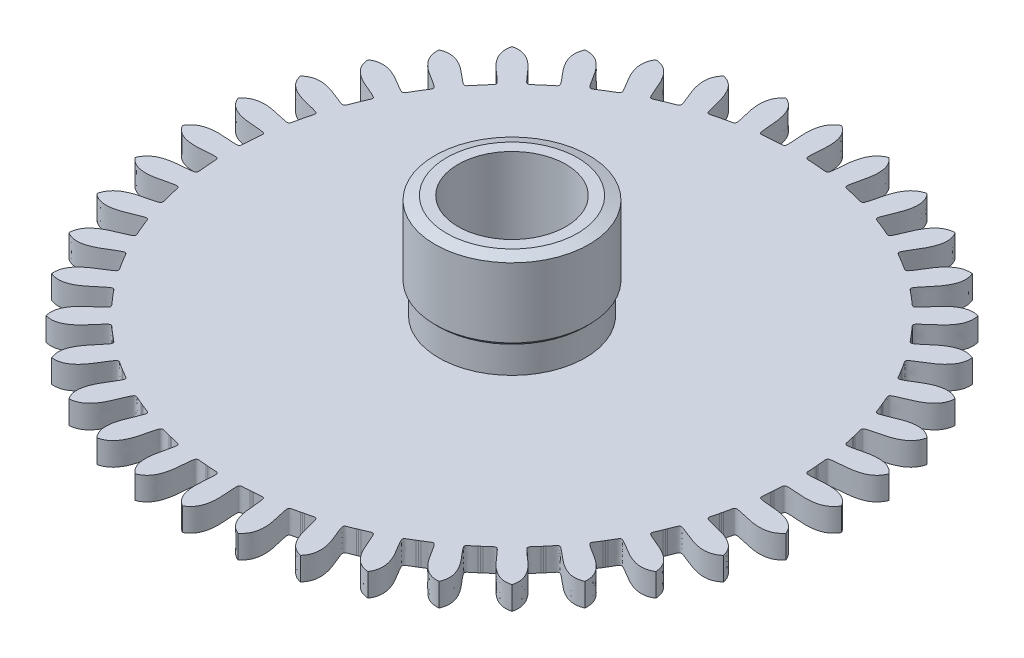
from build123d import *

# Parameters (mm, degrees)
BOSS_EXTRUDE1_40_TEETH_DEPTH = 0.3
SKETCH2_R                    = 0.95
BOSS_EXTRUDE2_DEPTH          = 0.35
SKETCH3_R                    = 1
BOSS_EXTRUDE3_DEPTH          = 1
CHAMFER1_SIZE                = 0.05
CHAMFER2_SIZE                = 0.05
CHAMFER2_SIZE2               = 0.15
CUT_EXTRUDE1_REACH           = 8.267
SKETCH4_R                    = 0.7


with BuildPart() as part:
    # Sketch1 → Boss-Extrude1 (40 teeth) (new body)
    with BuildSketch(Plane(origin=(0, 0, 0), x_dir=(1, 0, 0), z_dir=(0, 1, 0))):
        with BuildLine():
            Line((0.266399927, 3.665331646), (0.288337177, 3.663671201))
            Line((0.288337177, 3.663671201), (0.310264093, 3.661879462))
            add(Edge.make_bspline(
                [(0.668757338, 4.222367656), (0.581360588, 4.18682388), (0.475637691, 4.103302571), (0.459945668, 3.779977251), (0.454094522, 3.734621658), (0.440823774, 3.627045038), (0.415580001, 3.65779408), (0.310264093, 3.661879462)],
                knots=[0, 0, 0, 0, 0.596043429, 0.670236356, 0.733963386, 0.767736338, 1, 1, 1, 1], degree=3))
            add(Edge.make_bspline(
                [(0.668757338, 4.222367656), (0.740892956, 4.161556435), (0.815631902, 4.049452778), (0.730642884, 3.737103023), (0.722192005, 3.692159188), (0.701570233, 3.585746856), (0.735080464, 3.607190178), (0.836504297, 3.578531202)],
                knots=[0, 0, 0, 0, 0.596043429, 0.670236356, 0.733963386, 0.767736338, 1, 1, 1, 1], degree=3))
            Line((0.836504297, 3.578531202), (0.857911712, 3.573459457))
            Line((0.857911712, 3.573459457), (0.879288382, 3.568259652))
            add(Edge.make_bspline(
                [(1.321047651, 4.065766607), (1.229166628, 4.044332298), (1.111679745, 3.978377979), (1.045601692, 3.661488104), (1.032727406, 3.617606234), (1.002791352, 3.513430064), (0.982668582, 3.54774953), (0.879288382, 3.568259652)],
                knots=[0, 0, 0, 0, 0.596043429, 0.670236356, 0.733963386, 0.767736338, 1, 1, 1, 1], degree=3))
            add(Edge.make_bspline(
                [(1.321047651, 4.065766607), (1.382782189, 3.994419576), (1.439064099, 3.872004355), (1.30625917, 3.576795355), (1.290881571, 3.533726862), (1.253867131, 3.431850598), (1.29031927, 3.447787762), (1.386011155, 3.403615442)],
                knots=[0, 0, 0, 0, 0.596043429, 0.670236356, 0.733963386, 0.767736338, 1, 1, 1, 1], degree=3))
            Line((1.386011155, 3.403615442), (1.406361614, 3.395257282))
            Line((1.406361614, 3.395257282), (1.426661673, 3.386777446))
            add(Edge.make_bspline(
                [(1.940809386, 3.809052891), (1.846706507, 3.802255832), (1.720348553, 3.755492519), (1.605511533, 3.452840968), (1.585931114, 3.411513339), (1.540066879, 3.313302781), (1.525560601, 3.350347612), (1.426661673, 3.386777446)],
                knots=[0, 0, 0, 0, 0.596043429, 0.670236356, 0.733963386, 0.767736338, 1, 1, 1, 1], degree=3))
            add(Edge.make_bspline(
                [(1.940809386, 3.809052891), (1.990622735, 3.728926851), (2.027061761, 3.599214333), (1.84971102, 3.328415114), (1.827785348, 3.288282452), (1.775289658, 3.193450789), (1.813786132, 3.203489368), (1.901389819, 3.144891374)],
                knots=[0, 0, 0, 0, 0.596043429, 0.670236356, 0.733963386, 0.767736338, 1, 1, 1, 1], degree=3))
            Line((1.901389819, 3.144891374), (1.920182225, 3.133452604))
            Line((1.920182225, 3.133452604), (1.938905818, 3.12190154))
            add(Edge.make_bspline(
                [(2.512781954, 3.458547651), (2.418774342, 3.466555209), (2.286656671, 3.440134368), (2.125888352, 3.159173428), (2.100083935, 3.121417663), (2.039420848, 3.031590987), (2.030888255, 3.070449017), (1.938905818, 3.12190154)],
                knots=[0, 0, 0, 0, 0.596043429, 0.670236356, 0.733963386, 0.767736338, 1, 1, 1, 1], degree=3))
            add(Edge.make_bspline(
                [(2.512781954, 3.458547651), (2.549447543, 3.371615571), (2.565146436, 3.23779971), (2.347616846, 2.998078247), (2.319682983, 2.961869615), (2.252998662, 2.876417622), (2.292591561, 2.880310435), (2.369949955, 2.808729644)],
                knots=[0, 0, 0, 0, 0.596043429, 0.670236356, 0.733963386, 0.767736338, 1, 1, 1, 1], degree=3))
            Line((2.369949955, 2.808729644), (2.386721578, 2.794491924))
            Line((2.386721578, 2.794491924), (2.403407668, 2.780154058))
            add(Edge.make_bspline(
                [(3.02288149, 3.02288149), (2.931283926, 3.045496492), (2.796659712, 3.040068692), (2.593918744, 2.787716554), (2.562525719, 2.754462325), (2.488557508, 2.675231362), (2.4862087, 2.714945777), (2.403407668, 2.780154058)],
                knots=[0, 0, 0, 0, 0.596043429, 0.670236356, 0.733963386, 0.767736338, 1, 1, 1, 1], degree=3))
            add(Edge.make_bspline(
                [(3.02288149, 3.02288149), (3.045496492, 2.931283926), (3.040068692, 2.796659712), (2.787716554, 2.593918743), (2.754462325, 2.562525719), (2.675231362, 2.488557508), (2.714945777, 2.4862087), (2.780154058, 2.403407668)],
                knots=[0, 0, 0, 0, 0.596043429, 0.670236356, 0.733963386, 0.767736338, 1, 1, 1, 1], degree=3))
            Line((2.780154058, 2.403407668), (2.794491924, 2.386721578))
            Line((2.794491924, 2.386721578), (2.808729644, 2.369949955))
            add(Edge.make_bspline(
                [(3.458547651, 2.512781954), (3.371615571, 2.549447543), (3.23779971, 2.565146436), (2.998078247, 2.347616846), (2.961869615, 2.319682983), (2.876417622, 2.252998662), (2.880310435, 2.292591561), (2.808729644, 2.369949955)],
                knots=[0, 0, 0, 0, 0.596043429, 0.670236356, 0.733963386, 0.767736338, 1, 1, 1, 1], degree=3))
            add(Edge.make_bspline(
                [(3.458547651, 2.512781954), (3.466555209, 2.418774342), (3.440134368, 2.286656671), (3.159173428, 2.125888352), (3.121417663, 2.100083935), (3.031590987, 2.039420848), (3.070449017, 2.030888255), (3.12190154, 1.938905818)],
                knots=[0, 0, 0, 0, 0.596043429, 0.670236356, 0.733963386, 0.767736338, 1, 1, 1, 1], degree=3))
            Line((3.12190154, 1.938905818), (3.133452604, 1.920182225))
            Line((3.133452604, 1.920182225), (3.144891374, 1.901389819))
            add(Edge.make_bspline(
                [(3.809052891, 1.940809386), (3.728926851, 1.990622735), (3.599214333, 2.027061761), (3.328415114, 1.84971102), (3.288282452, 1.827785348), (3.193450789, 1.775289658), (3.203489368, 1.813786132), (3.144891374, 1.901389819)],
                knots=[0, 0, 0, 0, 0.596043429, 0.670236356, 0.733963386, 0.767736338, 1, 1, 1, 1], degree=3))
            add(Edge.make_bspline(
                [(3.809052891, 1.940809386), (3.802255832, 1.846706507), (3.755492519, 1.720348553), (3.452840968, 1.605511533), (3.411513339, 1.585931114), (3.313302781, 1.540066879), (3.350347612, 1.525560601), (3.386777446, 1.426661673)],
                knots=[0, 0, 0, 0, 0.596043429, 0.670236356, 0.733963386, 0.767736338, 1, 1, 1, 1], degree=3))
            Line((3.386777446, 1.426661673), (3.395257282, 1.406361614))
            Line((3.395257282, 1.406361614), (3.403615442, 1.386011155))
            add(Edge.make_bspline(
                [(4.065766607, 1.321047651), (3.994419576, 1.382782189), (3.872004355, 1.439064099), (3.576795355, 1.30625917), (3.533726862, 1.290881571), (3.431850598, 1.253867131), (3.447787762, 1.29031927), (3.403615442, 1.386011155)],
                knots=[0, 0, 0, 0, 0.596043429, 0.670236356, 0.733963386, 0.767736338, 1, 1, 1, 1], degree=3))
            add(Edge.make_bspline(
                [(4.065766607, 1.321047651), (4.044332298, 1.229166628), (3.978377979, 1.111679745), (3.661488104, 1.045601692), (3.617606234, 1.032727406), (3.513430064, 1.002791352), (3.54774953, 0.982668582), (3.568259652, 0.879288382)],
                knots=[0, 0, 0, 0, 0.596043429, 0.670236356, 0.733963386, 0.767736338, 1, 1, 1, 1], degree=3))
            Line((3.568259652, 0.879288382), (3.573459457, 0.857911712))
            Line((3.573459457, 0.857911712), (3.578531202, 0.836504297))
            add(Edge.make_bspline(
                [(4.222367656, 0.668757338), (4.161556435, 0.740892956), (4.049452778, 0.815631902), (3.737103023, 0.730642884), (3.692159188, 0.722192005), (3.585746856, 0.701570233), (3.607190178, 0.735080464), (3.578531202, 0.836504297)],
                knots=[0, 0, 0, 0, 0.596043429, 0.670236356, 0.733963386, 0.767736338, 1, 1, 1, 1], degree=3))
            add(Edge.make_bspline(
                [(4.222367656, 0.668757338), (4.18682388, 0.581360588), (4.103302571, 0.475637691), (3.779977251, 0.459945668), (3.734621658, 0.454094522), (3.627045038, 0.440823774), (3.65779408, 0.415580001), (3.661879462, 0.310264093)],
                knots=[0, 0, 0, 0, 0.596043429, 0.670236356, 0.733963386, 0.767736338, 1, 1, 1, 1], degree=3))
            Line((3.661879462, 0.310264093), (3.663671201, 0.288337177))
            Line((3.663671201, 0.288337177), (3.665331646, 0.266399927))
            add(Edge.make_bspline(
                [(4.275, 0), (4.226221963, 0.08076048), (4.127190235, 0.17211614), (3.805390813, 0.137035746), (3.759678302, 0.135719676), (3.651350126, 0.131998348), (3.6777716, 0.161741538), (3.665331646, 0.266399927)],
                knots=[0, 0, 0, 0, 0.596043429, 0.670236356, 0.733963386, 0.767736338, 1, 1, 1, 1], degree=3))
            add(Edge.make_bspline(
                [(4.275, 0), (4.226221963, -0.08076048), (4.127190235, -0.17211614), (3.805390813, -0.137035746), (3.759678302, -0.135719676), (3.651350126, -0.131998348), (3.6777716, -0.161741538), (3.665331646, -0.266399927)],
                knots=[0, 0, 0, 0, 0.596043429, 0.670236356, 0.733963386, 0.767736338, 1, 1, 1, 1], degree=3))
            Line((3.665331646, -0.266399927), (3.663671201, -0.288337177))
            Line((3.663671201, -0.288337177), (3.661879462, -0.310264093))
            add(Edge.make_bspline(
                [(4.222367656, -0.668757338), (4.18682388, -0.581360588), (4.103302571, -0.475637691), (3.779977251, -0.459945668), (3.734621658, -0.454094522), (3.627045038, -0.440823774), (3.65779408, -0.415580001), (3.661879462, -0.310264093)],
                knots=[0, 0, 0, 0, 0.596043429, 0.670236356, 0.733963386, 0.767736338, 1, 1, 1, 1], degree=3))
            add(Edge.make_bspline(
                [(4.222367656, -0.668757338), (4.161556435, -0.740892956), (4.049452778, -0.815631902), (3.737103023, -0.730642884), (3.692159188, -0.722192005), (3.585746856, -0.701570233), (3.607190178, -0.735080464), (3.578531202, -0.836504297)],
                knots=[0, 0, 0, 0, 0.596043429, 0.670236356, 0.733963386, 0.767736338, 1, 1, 1, 1], degree=3))
            Line((3.578531202, -0.836504297), (3.573459457, -0.857911712))
            Line((3.573459457, -0.857911712), (3.568259652, -0.879288382))
            add(Edge.make_bspline(
                [(4.065766607, -1.321047651), (4.044332298, -1.229166628), (3.978377979, -1.111679745), (3.661488104, -1.045601692), (3.617606234, -1.032727406), (3.513430064, -1.002791352), (3.54774953, -0.982668582), (3.568259652, -0.879288382)],
                knots=[0, 0, 0, 0, 0.596043429, 0.670236356, 0.733963386, 0.767736338, 1, 1, 1, 1], degree=3))
            add(Edge.make_bspline(
                [(4.065766607, -1.321047651), (3.994419576, -1.382782189), (3.872004355, -1.439064099), (3.576795355, -1.30625917), (3.533726862, -1.290881571), (3.431850598, -1.253867131), (3.447787762, -1.29031927), (3.403615442, -1.386011155)],
                knots=[0, 0, 0, 0, 0.596043429, 0.670236356, 0.733963386, 0.767736338, 1, 1, 1, 1], degree=3))
            Line((3.403615442, -1.386011155), (3.395257282, -1.406361614))
            Line((3.395257282, -1.406361614), (3.386777446, -1.426661673))
            add(Edge.make_bspline(
                [(3.809052891, -1.940809386), (3.802255832, -1.846706507), (3.755492519, -1.720348553), (3.452840968, -1.605511533), (3.411513339, -1.585931114), (3.313302781, -1.540066879), (3.350347612, -1.525560601), (3.386777446, -1.426661673)],
                knots=[0, 0, 0, 0, 0.596043429, 0.670236356, 0.733963386, 0.767736338, 1, 1, 1, 1], degree=3))
            add(Edge.make_bspline(
                [(3.809052891, -1.940809386), (3.728926851, -1.990622735), (3.599214333, -2.027061761), (3.328415114, -1.84971102), (3.288282452, -1.827785348), (3.193450789, -1.775289658), (3.203489368, -1.813786132), (3.144891374, -1.901389819)],
                knots=[0, 0, 0, 0, 0.596043429, 0.670236356, 0.733963386, 0.767736338, 1, 1, 1, 1], degree=3))
            Line((3.144891374, -1.901389819), (3.133452604, -1.920182225))
            Line((3.133452604, -1.920182225), (3.12190154, -1.938905818))
            add(Edge.make_bspline(
                [(3.458547651, -2.512781954), (3.466555209, -2.418774342), (3.440134368, -2.286656671), (3.159173428, -2.125888352), (3.121417663, -2.100083935), (3.031590987, -2.039420848), (3.070449017, -2.030888255), (3.12190154, -1.938905818)],
                knots=[0, 0, 0, 0, 0.596043429, 0.670236356, 0.733963386, 0.767736338, 1, 1, 1, 1], degree=3))
            add(Edge.make_bspline(
                [(3.458547651, -2.512781954), (3.371615571, -2.549447543), (3.23779971, -2.565146436), (2.998078247, -2.347616846), (2.961869615, -2.319682983), (2.876417622, -2.252998662), (2.880310435, -2.292591561), (2.808729644, -2.369949955)],
                knots=[0, 0, 0, 0, 0.596043429, 0.670236356, 0.733963386, 0.767736338, 1, 1, 1, 1], degree=3))
            Line((2.808729644, -2.369949955), (2.794491924, -2.386721578))
            Line((2.794491924, -2.386721578), (2.780154058, -2.403407668))
            add(Edge.make_bspline(
                [(3.02288149, -3.02288149), (3.045496492, -2.931283926), (3.040068692, -2.796659712), (2.787716554, -2.593918744), (2.754462325, -2.562525719), (2.675231362, -2.488557508), (2.714945777, -2.4862087), (2.780154058, -2.403407668)],
                knots=[0, 0, 0, 0, 0.596043429, 0.670236356, 0.733963386, 0.767736338, 1, 1, 1, 1], degree=3))
            add(Edge.make_bspline(
                [(3.02288149, -3.02288149), (2.931283926, -3.045496492), (2.796659712, -3.040068692), (2.593918743, -2.787716554), (2.562525719, -2.754462325), (2.488557508, -2.675231362), (2.4862087, -2.714945777), (2.403407668, -2.780154058)],
                knots=[0, 0, 0, 0, 0.596043429, 0.670236356, 0.733963386, 0.767736338, 1, 1, 1, 1], degree=3))
            Line((2.403407668, -2.780154058), (2.386721578, -2.794491924))
            Line((2.386721578, -2.794491924), (2.369949955, -2.808729644))
            add(Edge.make_bspline(
                [(2.512781954, -3.458547651), (2.549447543, -3.371615571), (2.565146436, -3.23779971), (2.347616846, -2.998078247), (2.319682983, -2.961869615), (2.252998662, -2.876417622), (2.292591561, -2.880310435), (2.369949955, -2.808729644)],
                knots=[0, 0, 0, 0, 0.596043429, 0.670236356, 0.733963386, 0.767736338, 1, 1, 1, 1], degree=3))
            add(Edge.make_bspline(
                [(2.512781954, -3.458547651), (2.418774342, -3.466555209), (2.286656671, -3.440134368), (2.125888352, -3.159173428), (2.100083935, -3.121417663), (2.039420848, -3.031590987), (2.030888255, -3.070449017), (1.938905818, -3.12190154)],
                knots=[0, 0, 0, 0, 0.596043429, 0.670236356, 0.733963386, 0.767736338, 1, 1, 1, 1], degree=3))
            Line((1.938905818, -3.12190154), (1.920182225, -3.133452604))
            Line((1.920182225, -3.133452604), (1.901389819, -3.144891374))
            add(Edge.make_bspline(
                [(1.940809386, -3.809052891), (1.990622735, -3.728926851), (2.027061761, -3.599214333), (1.84971102, -3.328415114), (1.827785348, -3.288282452), (1.775289658, -3.193450789), (1.813786132, -3.203489368), (1.901389819, -3.144891374)],
                knots=[0, 0, 0, 0, 0.596043429, 0.670236356, 0.733963386, 0.767736338, 1, 1, 1, 1], degree=3))
            add(Edge.make_bspline(
                [(1.940809386, -3.809052891), (1.846706507, -3.802255832), (1.720348553, -3.755492519), (1.605511533, -3.452840968), (1.585931114, -3.411513339), (1.540066879, -3.313302781), (1.525560601, -3.350347612), (1.426661673, -3.386777446)],
                knots=[0, 0, 0, 0, 0.596043429, 0.670236356, 0.733963386, 0.767736338, 1, 1, 1, 1], degree=3))
            Line((1.426661673, -3.386777446), (1.406361614, -3.395257282))
            Line((1.406361614, -3.395257282), (1.386011155, -3.403615442))
            add(Edge.make_bspline(
                [(1.321047651, -4.065766607), (1.382782189, -3.994419576), (1.439064099, -3.872004355), (1.30625917, -3.576795355), (1.290881571, -3.533726862), (1.253867131, -3.431850598), (1.29031927, -3.447787762), (1.386011155, -3.403615442)],
                knots=[0, 0, 0, 0, 0.596043429, 0.670236356, 0.733963386, 0.767736338, 1, 1, 1, 1], degree=3))
            add(Edge.make_bspline(
                [(1.321047651, -4.065766607), (1.229166628, -4.044332298), (1.111679745, -3.978377979), (1.045601692, -3.661488104), (1.032727406, -3.617606234), (1.002791352, -3.513430064), (0.982668582, -3.54774953), (0.879288382, -3.568259652)],
                knots=[0, 0, 0, 0, 0.596043429, 0.670236356, 0.733963386, 0.767736338, 1, 1, 1, 1], degree=3))
            Line((0.879288382, -3.568259652), (0.857911712, -3.573459457))
            Line((0.857911712, -3.573459457), (0.836504297, -3.578531202))
            add(Edge.make_bspline(
                [(0.668757338, -4.222367656), (0.740892956, -4.161556435), (0.815631902, -4.049452778), (0.730642884, -3.737103023), (0.722192005, -3.692159188), (0.701570233, -3.585746856), (0.735080464, -3.607190178), (0.836504297, -3.578531202)],
                knots=[0, 0, 0, 0, 0.596043429, 0.670236356, 0.733963386, 0.767736338, 1, 1, 1, 1], degree=3))
            add(Edge.make_bspline(
                [(0.668757338, -4.222367656), (0.581360588, -4.18682388), (0.475637691, -4.103302571), (0.459945668, -3.779977251), (0.454094522, -3.734621658), (0.440823774, -3.627045038), (0.415580001, -3.65779408), (0.310264093, -3.661879462)],
                knots=[0, 0, 0, 0, 0.596043429, 0.670236356, 0.733963386, 0.767736338, 1, 1, 1, 1], degree=3))
            Line((0.310264093, -3.661879462), (0.288337177, -3.663671201))
            Line((0.288337177, -3.663671201), (0.266399927, -3.665331646))
            add(Edge.make_bspline(
                [(0, -4.275), (0.08076048, -4.226221963), (0.17211614, -4.127190235), (0.137035746, -3.805390813), (0.135719676, -3.759678302), (0.131998348, -3.651350126), (0.161741538, -3.6777716), (0.266399927, -3.665331646)],
                knots=[0, 0, 0, 0, 0.596043429, 0.670236356, 0.733963386, 0.767736338, 1, 1, 1, 1], degree=3))
            add(Edge.make_bspline(
                [(0, -4.275), (-0.08076048, -4.226221963), (-0.17211614, -4.127190235), (-0.137035746, -3.805390813), (-0.135719676, -3.759678302), (-0.131998348, -3.651350126), (-0.161741538, -3.6777716), (-0.266399927, -3.665331646)],
                knots=[0, 0, 0, 0, 0.596043429, 0.670236356, 0.733963386, 0.767736338, 1, 1, 1, 1], degree=3))
            Line((-0.266399927, -3.665331646), (-0.288337177, -3.663671201))
            Line((-0.288337177, -3.663671201), (-0.310264093, -3.661879462))
            add(Edge.make_bspline(
                [(-0.668757338, -4.222367656), (-0.581360588, -4.18682388), (-0.475637691, -4.103302571), (-0.459945668, -3.779977251), (-0.454094522, -3.734621658), (-0.440823774, -3.627045038), (-0.415580001, -3.65779408), (-0.310264093, -3.661879462)],
                knots=[0, 0, 0, 0, 0.596043429, 0.670236356, 0.733963386, 0.767736338, 1, 1, 1, 1], degree=3))
            add(Edge.make_bspline(
                [(-0.668757338, -4.222367656), (-0.740892956, -4.161556435), (-0.815631902, -4.049452778), (-0.730642884, -3.737103023), (-0.722192005, -3.692159188), (-0.701570233, -3.585746856), (-0.735080464, -3.607190178), (-0.836504297, -3.578531202)],
                knots=[0, 0, 0, 0, 0.596043429, 0.670236356, 0.733963386, 0.767736338, 1, 1, 1, 1], degree=3))
            Line((-0.836504297, -3.578531202), (-0.857911712, -3.573459457))
            Line((-0.857911712, -3.573459457), (-0.879288382, -3.568259652))
            add(Edge.make_bspline(
                [(-1.321047651, -4.065766607), (-1.229166628, -4.044332298), (-1.111679745, -3.978377979), (-1.045601692, -3.661488104), (-1.032727406, -3.617606234), (-1.002791352, -3.513430064), (-0.982668582, -3.54774953), (-0.879288382, -3.568259652)],
                knots=[0, 0, 0, 0, 0.596043429, 0.670236356, 0.733963386, 0.767736338, 1, 1, 1, 1], degree=3))
            add(Edge.make_bspline(
                [(-1.321047651, -4.065766607), (-1.382782189, -3.994419576), (-1.439064099, -3.872004355), (-1.30625917, -3.576795355), (-1.290881571, -3.533726862), (-1.253867131, -3.431850598), (-1.29031927, -3.447787762), (-1.386011155, -3.403615442)],
                knots=[0, 0, 0, 0, 0.596043429, 0.670236356, 0.733963386, 0.767736338, 1, 1, 1, 1], degree=3))
            Line((-1.386011155, -3.403615442), (-1.406361614, -3.395257282))
            Line((-1.406361614, -3.395257282), (-1.426661673, -3.386777446))
            add(Edge.make_bspline(
                [(-1.940809386, -3.809052891), (-1.846706507, -3.802255832), (-1.720348553, -3.755492519), (-1.605511533, -3.452840968), (-1.585931114, -3.411513339), (-1.540066879, -3.313302781), (-1.525560601, -3.350347612), (-1.426661673, -3.386777446)],
                knots=[0, 0, 0, 0, 0.596043429, 0.670236356, 0.733963386, 0.767736338, 1, 1, 1, 1], degree=3))
            add(Edge.make_bspline(
                [(-1.940809386, -3.809052891), (-1.990622735, -3.728926851), (-2.027061761, -3.599214333), (-1.84971102, -3.328415114), (-1.827785348, -3.288282452), (-1.775289658, -3.193450789), (-1.813786132, -3.203489368), (-1.901389819, -3.144891374)],
                knots=[0, 0, 0, 0, 0.596043429, 0.670236356, 0.733963386, 0.767736338, 1, 1, 1, 1], degree=3))
            Line((-1.901389819, -3.144891374), (-1.920182225, -3.133452604))
            Line((-1.920182225, -3.133452604), (-1.938905818, -3.12190154))
            add(Edge.make_bspline(
                [(-2.512781954, -3.458547651), (-2.418774342, -3.466555209), (-2.286656671, -3.440134368), (-2.125888352, -3.159173428), (-2.100083935, -3.121417663), (-2.039420848, -3.031590987), (-2.030888255, -3.070449017), (-1.938905818, -3.12190154)],
                knots=[0, 0, 0, 0, 0.596043429, 0.670236356, 0.733963386, 0.767736338, 1, 1, 1, 1], degree=3))
            add(Edge.make_bspline(
                [(-2.512781954, -3.458547651), (-2.549447543, -3.371615571), (-2.565146436, -3.23779971), (-2.347616846, -2.998078247), (-2.319682983, -2.961869615), (-2.252998662, -2.876417622), (-2.292591561, -2.880310435), (-2.369949955, -2.808729644)],
                knots=[0, 0, 0, 0, 0.596043429, 0.670236356, 0.733963386, 0.767736338, 1, 1, 1, 1], degree=3))
            Line((-2.369949955, -2.808729644), (-2.386721578, -2.794491924))
            Line((-2.386721578, -2.794491924), (-2.403407668, -2.780154058))
            add(Edge.make_bspline(
                [(-3.02288149, -3.02288149), (-2.931283926, -3.045496492), (-2.796659712, -3.040068692), (-2.593918744, -2.787716554), (-2.562525719, -2.754462325), (-2.488557508, -2.675231362), (-2.4862087, -2.714945777), (-2.403407668, -2.780154058)],
                knots=[0, 0, 0, 0, 0.596043429, 0.670236356, 0.733963386, 0.767736338, 1, 1, 1, 1], degree=3))
            add(Edge.make_bspline(
                [(-3.02288149, -3.02288149), (-3.045496492, -2.931283926), (-3.040068692, -2.796659712), (-2.787716554, -2.593918743), (-2.754462325, -2.562525719), (-2.675231362, -2.488557508), (-2.714945777, -2.4862087), (-2.780154058, -2.403407668)],
                knots=[0, 0, 0, 0, 0.596043429, 0.670236356, 0.733963386, 0.767736338, 1, 1, 1, 1], degree=3))
            Line((-2.780154058, -2.403407668), (-2.794491924, -2.386721578))
            Line((-2.794491924, -2.386721578), (-2.808729644, -2.369949955))
            add(Edge.make_bspline(
                [(-3.458547651, -2.512781954), (-3.371615571, -2.549447543), (-3.23779971, -2.565146436), (-2.998078247, -2.347616846), (-2.961869615, -2.319682983), (-2.876417622, -2.252998662), (-2.880310435, -2.292591561), (-2.808729644, -2.369949955)],
                knots=[0, 0, 0, 0, 0.596043429, 0.670236356, 0.733963386, 0.767736338, 1, 1, 1, 1], degree=3))
            add(Edge.make_bspline(
                [(-3.458547651, -2.512781954), (-3.466555209, -2.418774342), (-3.440134368, -2.286656671), (-3.159173428, -2.125888352), (-3.121417663, -2.100083935), (-3.031590987, -2.039420848), (-3.070449017, -2.030888255), (-3.12190154, -1.938905818)],
                knots=[0, 0, 0, 0, 0.596043429, 0.670236356, 0.733963386, 0.767736338, 1, 1, 1, 1], degree=3))
            Line((-3.12190154, -1.938905818), (-3.133452604, -1.920182225))
            Line((-3.133452604, -1.920182225), (-3.144891374, -1.901389819))
            add(Edge.make_bspline(
                [(-3.809052891, -1.940809386), (-3.728926851, -1.990622735), (-3.599214333, -2.027061761), (-3.328415114, -1.84971102), (-3.288282452, -1.827785348), (-3.193450789, -1.775289658), (-3.203489368, -1.813786132), (-3.144891374, -1.901389819)],
                knots=[0, 0, 0, 0, 0.596043429, 0.670236356, 0.733963386, 0.767736338, 1, 1, 1, 1], degree=3))
            add(Edge.make_bspline(
                [(-3.809052891, -1.940809386), (-3.802255832, -1.846706507), (-3.755492519, -1.720348553), (-3.452840968, -1.605511533), (-3.411513339, -1.585931114), (-3.313302781, -1.540066879), (-3.350347612, -1.525560601), (-3.386777446, -1.426661673)],
                knots=[0, 0, 0, 0, 0.596043429, 0.670236356, 0.733963386, 0.767736338, 1, 1, 1, 1], degree=3))
            Line((-3.386777446, -1.426661673), (-3.395257282, -1.406361614))
            Line((-3.395257282, -1.406361614), (-3.403615442, -1.386011155))
            add(Edge.make_bspline(
                [(-4.065766607, -1.321047651), (-3.994419576, -1.382782189), (-3.872004355, -1.439064099), (-3.576795355, -1.30625917), (-3.533726862, -1.290881571), (-3.431850598, -1.253867131), (-3.447787762, -1.29031927), (-3.403615442, -1.386011155)],
                knots=[0, 0, 0, 0, 0.596043429, 0.670236356, 0.733963386, 0.767736338, 1, 1, 1, 1], degree=3))
            add(Edge.make_bspline(
                [(-4.065766607, -1.321047651), (-4.044332298, -1.229166628), (-3.978377979, -1.111679745), (-3.661488104, -1.045601692), (-3.617606234, -1.032727406), (-3.513430064, -1.002791352), (-3.54774953, -0.982668582), (-3.568259652, -0.879288382)],
                knots=[0, 0, 0, 0, 0.596043429, 0.670236356, 0.733963386, 0.767736338, 1, 1, 1, 1], degree=3))
            Line((-3.568259652, -0.879288382), (-3.573459457, -0.857911712))
            Line((-3.573459457, -0.857911712), (-3.578531202, -0.836504297))
            add(Edge.make_bspline(
                [(-4.222367656, -0.668757338), (-4.161556435, -0.740892956), (-4.049452778, -0.815631902), (-3.737103023, -0.730642884), (-3.692159188, -0.722192005), (-3.585746856, -0.701570233), (-3.607190178, -0.735080464), (-3.578531202, -0.836504297)],
                knots=[0, 0, 0, 0, 0.596043429, 0.670236356, 0.733963386, 0.767736338, 1, 1, 1, 1], degree=3))
            add(Edge.make_bspline(
                [(-4.222367656, -0.668757338), (-4.18682388, -0.581360588), (-4.103302571, -0.475637691), (-3.779977251, -0.459945668), (-3.734621658, -0.454094522), (-3.627045038, -0.440823774), (-3.65779408, -0.415580001), (-3.661879462, -0.310264093)],
                knots=[0, 0, 0, 0, 0.596043429, 0.670236356, 0.733963386, 0.767736338, 1, 1, 1, 1], degree=3))
            Line((-3.661879462, -0.310264093), (-3.663671201, -0.288337177))
            Line((-3.663671201, -0.288337177), (-3.665331646, -0.266399927))
            add(Edge.make_bspline(
                [(-4.275, 0), (-4.226221963, -0.08076048), (-4.127190235, -0.17211614), (-3.805390813, -0.137035746), (-3.759678302, -0.135719676), (-3.651350126, -0.131998348), (-3.6777716, -0.161741538), (-3.665331646, -0.266399927)],
                knots=[0, 0, 0, 0, 0.596043429, 0.670236356, 0.733963386, 0.767736338, 1, 1, 1, 1], degree=3))
            add(Edge.make_bspline(
                [(-4.275, 0), (-4.226221963, 0.08076048), (-4.127190235, 0.17211614), (-3.805390813, 0.137035746), (-3.759678302, 0.135719676), (-3.651350126, 0.131998348), (-3.6777716, 0.161741538), (-3.665331646, 0.266399927)],
                knots=[0, 0, 0, 0, 0.596043429, 0.670236356, 0.733963386, 0.767736338, 1, 1, 1, 1], degree=3))
            Line((-3.665331646, 0.266399927), (-3.663671201, 0.288337177))
            Line((-3.663671201, 0.288337177), (-3.661879462, 0.310264093))
            add(Edge.make_bspline(
                [(-4.222367656, 0.668757338), (-4.18682388, 0.581360588), (-4.103302571, 0.475637691), (-3.779977251, 0.459945668), (-3.734621658, 0.454094522), (-3.627045038, 0.440823774), (-3.65779408, 0.415580001), (-3.661879462, 0.310264093)],
                knots=[0, 0, 0, 0, 0.596043429, 0.670236356, 0.733963386, 0.767736338, 1, 1, 1, 1], degree=3))
            add(Edge.make_bspline(
                [(-4.222367656, 0.668757338), (-4.161556435, 0.740892956), (-4.049452778, 0.815631902), (-3.737103023, 0.730642884), (-3.692159188, 0.722192005), (-3.585746856, 0.701570233), (-3.607190178, 0.735080464), (-3.578531202, 0.836504297)],
                knots=[0, 0, 0, 0, 0.596043429, 0.670236356, 0.733963386, 0.767736338, 1, 1, 1, 1], degree=3))
            Line((-3.578531202, 0.836504297), (-3.573459457, 0.857911712))
            Line((-3.573459457, 0.857911712), (-3.568259652, 0.879288382))
            add(Edge.make_bspline(
                [(-4.065766607, 1.321047651), (-4.044332298, 1.229166628), (-3.978377979, 1.111679745), (-3.661488104, 1.045601692), (-3.617606234, 1.032727406), (-3.513430064, 1.002791352), (-3.54774953, 0.982668582), (-3.568259652, 0.879288382)],
                knots=[0, 0, 0, 0, 0.596043429, 0.670236356, 0.733963386, 0.767736338, 1, 1, 1, 1], degree=3))
            add(Edge.make_bspline(
                [(-4.065766607, 1.321047651), (-3.994419576, 1.382782189), (-3.872004355, 1.439064099), (-3.576795355, 1.30625917), (-3.533726862, 1.290881571), (-3.431850598, 1.253867131), (-3.447787762, 1.29031927), (-3.403615442, 1.386011155)],
                knots=[0, 0, 0, 0, 0.596043429, 0.670236356, 0.733963386, 0.767736338, 1, 1, 1, 1], degree=3))
            Line((-3.403615442, 1.386011155), (-3.395257282, 1.406361614))
            Line((-3.395257282, 1.406361614), (-3.386777446, 1.426661673))
            add(Edge.make_bspline(
                [(-3.809052891, 1.940809386), (-3.802255832, 1.846706507), (-3.755492519, 1.720348553), (-3.452840968, 1.605511533), (-3.411513339, 1.585931114), (-3.313302781, 1.540066879), (-3.350347612, 1.525560601), (-3.386777446, 1.426661673)],
                knots=[0, 0, 0, 0, 0.596043429, 0.670236356, 0.733963386, 0.767736338, 1, 1, 1, 1], degree=3))
            add(Edge.make_bspline(
                [(-3.809052891, 1.940809386), (-3.728926851, 1.990622735), (-3.599214333, 2.027061761), (-3.328415114, 1.84971102), (-3.288282452, 1.827785348), (-3.193450789, 1.775289658), (-3.203489368, 1.813786132), (-3.144891374, 1.901389819)],
                knots=[0, 0, 0, 0, 0.596043429, 0.670236356, 0.733963386, 0.767736338, 1, 1, 1, 1], degree=3))
            Line((-3.144891374, 1.901389819), (-3.133452604, 1.920182225))
            Line((-3.133452604, 1.920182225), (-3.12190154, 1.938905818))
            add(Edge.make_bspline(
                [(-3.458547651, 2.512781954), (-3.466555209, 2.418774342), (-3.440134368, 2.286656671), (-3.159173428, 2.125888352), (-3.121417663, 2.100083935), (-3.031590987, 2.039420848), (-3.070449017, 2.030888255), (-3.12190154, 1.938905818)],
                knots=[0, 0, 0, 0, 0.596043429, 0.670236356, 0.733963386, 0.767736338, 1, 1, 1, 1], degree=3))
            add(Edge.make_bspline(
                [(-3.458547651, 2.512781954), (-3.371615571, 2.549447543), (-3.23779971, 2.565146436), (-2.998078247, 2.347616846), (-2.961869615, 2.319682983), (-2.876417622, 2.252998662), (-2.880310435, 2.292591561), (-2.808729644, 2.369949955)],
                knots=[0, 0, 0, 0, 0.596043429, 0.670236356, 0.733963386, 0.767736338, 1, 1, 1, 1], degree=3))
            Line((-2.808729644, 2.369949955), (-2.794491924, 2.386721578))
            Line((-2.794491924, 2.386721578), (-2.780154058, 2.403407668))
            add(Edge.make_bspline(
                [(-3.02288149, 3.02288149), (-3.045496492, 2.931283926), (-3.040068692, 2.796659712), (-2.787716554, 2.593918744), (-2.754462325, 2.562525719), (-2.675231362, 2.488557508), (-2.714945777, 2.4862087), (-2.780154058, 2.403407668)],
                knots=[0, 0, 0, 0, 0.596043429, 0.670236356, 0.733963386, 0.767736338, 1, 1, 1, 1], degree=3))
            add(Edge.make_bspline(
                [(-3.02288149, 3.02288149), (-2.931283926, 3.045496492), (-2.796659712, 3.040068692), (-2.593918743, 2.787716554), (-2.562525719, 2.754462325), (-2.488557508, 2.675231362), (-2.4862087, 2.714945777), (-2.403407668, 2.780154058)],
                knots=[0, 0, 0, 0, 0.596043429, 0.670236356, 0.733963386, 0.767736338, 1, 1, 1, 1], degree=3))
            Line((-2.403407668, 2.780154058), (-2.386721578, 2.794491924))
            Line((-2.386721578, 2.794491924), (-2.369949955, 2.808729644))
            add(Edge.make_bspline(
                [(-2.512781954, 3.458547651), (-2.549447543, 3.371615571), (-2.565146436, 3.23779971), (-2.347616846, 2.998078247), (-2.319682983, 2.961869615), (-2.252998662, 2.876417622), (-2.292591561, 2.880310435), (-2.369949955, 2.808729644)],
                knots=[0, 0, 0, 0, 0.596043429, 0.670236356, 0.733963386, 0.767736338, 1, 1, 1, 1], degree=3))
            add(Edge.make_bspline(
                [(-2.512781954, 3.458547651), (-2.418774342, 3.466555209), (-2.286656671, 3.440134368), (-2.125888352, 3.159173428), (-2.100083935, 3.121417663), (-2.039420848, 3.031590987), (-2.030888255, 3.070449017), (-1.938905818, 3.12190154)],
                knots=[0, 0, 0, 0, 0.596043429, 0.670236356, 0.733963386, 0.767736338, 1, 1, 1, 1], degree=3))
            Line((-1.938905818, 3.12190154), (-1.920182225, 3.133452604))
            Line((-1.920182225, 3.133452604), (-1.901389819, 3.144891374))
            add(Edge.make_bspline(
                [(-1.940809386, 3.809052891), (-1.990622735, 3.728926851), (-2.027061761, 3.599214333), (-1.84971102, 3.328415114), (-1.827785348, 3.288282452), (-1.775289658, 3.193450789), (-1.813786132, 3.203489368), (-1.901389819, 3.144891374)],
                knots=[0, 0, 0, 0, 0.596043429, 0.670236356, 0.733963386, 0.767736338, 1, 1, 1, 1], degree=3))
            add(Edge.make_bspline(
                [(-1.940809386, 3.809052891), (-1.846706507, 3.802255832), (-1.720348553, 3.755492519), (-1.605511533, 3.452840968), (-1.585931114, 3.411513339), (-1.540066879, 3.313302781), (-1.525560601, 3.350347612), (-1.426661673, 3.386777446)],
                knots=[0, 0, 0, 0, 0.596043429, 0.670236356, 0.733963386, 0.767736338, 1, 1, 1, 1], degree=3))
            Line((-1.426661673, 3.386777446), (-1.406361614, 3.395257282))
            Line((-1.406361614, 3.395257282), (-1.386011155, 3.403615442))
            add(Edge.make_bspline(
                [(-1.321047651, 4.065766607), (-1.382782189, 3.994419576), (-1.439064099, 3.872004355), (-1.30625917, 3.576795355), (-1.290881571, 3.533726862), (-1.253867131, 3.431850598), (-1.29031927, 3.447787762), (-1.386011155, 3.403615442)],
                knots=[0, 0, 0, 0, 0.596043429, 0.670236356, 0.733963386, 0.767736338, 1, 1, 1, 1], degree=3))
            add(Edge.make_bspline(
                [(-1.321047651, 4.065766607), (-1.229166628, 4.044332298), (-1.111679745, 3.978377979), (-1.045601692, 3.661488104), (-1.032727406, 3.617606234), (-1.002791352, 3.513430064), (-0.982668582, 3.54774953), (-0.879288382, 3.568259652)],
                knots=[0, 0, 0, 0, 0.596043429, 0.670236356, 0.733963386, 0.767736338, 1, 1, 1, 1], degree=3))
            Line((-0.879288382, 3.568259652), (-0.857911712, 3.573459457))
            Line((-0.857911712, 3.573459457), (-0.836504297, 3.578531202))
            add(Edge.make_bspline(
                [(-0.668757338, 4.222367656), (-0.740892956, 4.161556435), (-0.815631902, 4.049452778), (-0.730642884, 3.737103023), (-0.722192005, 3.692159188), (-0.701570233, 3.585746856), (-0.735080464, 3.607190178), (-0.836504297, 3.578531202)],
                knots=[0, 0, 0, 0, 0.596043429, 0.670236356, 0.733963386, 0.767736338, 1, 1, 1, 1], degree=3))
            add(Edge.make_bspline(
                [(-0.668757338, 4.222367656), (-0.581360588, 4.18682388), (-0.475637691, 4.103302571), (-0.459945668, 3.779977251), (-0.454094522, 3.734621658), (-0.440823774, 3.627045038), (-0.415580001, 3.65779408), (-0.310264093, 3.661879462)],
                knots=[0, 0, 0, 0, 0.596043429, 0.670236356, 0.733963386, 0.767736338, 1, 1, 1, 1], degree=3))
            Line((-0.310264093, 3.661879462), (-0.288337177, 3.663671201))
            Line((-0.288337177, 3.663671201), (-0.266399927, 3.665331646))
            add(Edge.make_bspline(
                [(0, 4.275), (-0.08076048, 4.226221963), (-0.17211614, 4.127190235), (-0.137035746, 3.805390813), (-0.135719676, 3.759678302), (-0.131998348, 3.651350126), (-0.161741538, 3.6777716), (-0.266399927, 3.665331646)],
                knots=[0, 0, 0, 0, 0.596043429, 0.670236356, 0.733963386, 0.767736338, 1, 1, 1, 1], degree=3))
            add(Edge.make_bspline(
                [(0, 4.275), (0.08076048, 4.226221963), (0.17211614, 4.127190235), (0.137035746, 3.805390813), (0.135719676, 3.759678302), (0.131998348, 3.651350126), (0.161741538, 3.6777716), (0.266399927, 3.665331646)],
                knots=[0, 0, 0, 0, 0.596043429, 0.670236356, 0.733963386, 0.767736338, 1, 1, 1, 1], degree=3))
        make_face()
    extrude(amount=BOSS_EXTRUDE1_40_TEETH_DEPTH)

    # Sketch2 → Boss-Extrude2 (add)
    with BuildSketch(Plane(origin=(0, 0.3, 0), x_dir=(1, 0, 0), z_dir=(0, 1, 0))):
        with Locations(Location((0, 0, 0), (0, 0, 90))):
            Circle(SKETCH2_R)
    extrude(amount=BOSS_EXTRUDE2_DEPTH)

    # Sketch3 → Boss-Extrude3 (add)
    with BuildSketch(Plane(origin=(0, 0.65, 0), x_dir=(1, 0, 0), z_dir=(0, 1, 0))):
        with Locations(Location((0, 0, 0), (0, 0, 270))):
            Circle(SKETCH3_R)
    extrude(amount=BOSS_EXTRUDE3_DEPTH)

    # Chamfer1
    chamfer1_edges = [part.edges().sort_by_distance(p)[0] for p in [
        (0, 0.65, -1),
    ]]
    chamfer(chamfer1_edges, length=CHAMFER1_SIZE - 0.0001)  # a hair under: the kernel refuses the full size

    # Chamfer2
    chamfer2_edges = [part.edges().sort_by_distance(p)[0] for p in [
        (0, 1.65, -1),
    ]]
    chamfer2_side = [part.faces().sort_by_distance(p)[0] for p in [
        (0, 1.17495, -1),
    ]]
    chamfer(chamfer2_edges, length=CHAMFER2_SIZE, length2=CHAMFER2_SIZE2, reference=chamfer2_side[0])

    # Sketch4 → Cut-Extrude1 (cut, up to next)
    with BuildSketch(Plane(origin=(0, 0, 0), x_dir=(1, 0, 0), z_dir=(0, 1, 0)), mode=Mode.PRIVATE) as cut_extrude1_sk1:
        with Locations(Location((0, 0, 0), (0, 0, 90))):
            Circle(SKETCH4_R)
    cut_extrude1_tool1 = extrude(cut_extrude1_sk1.sketch, amount=CUT_EXTRUDE1_REACH, mode=Mode.PRIVATE) & part.part
    add(cut_extrude1_tool1.solids().sort_by_distance((0, 0, 0))[0], mode=Mode.SUBTRACT)


solid = part.part
